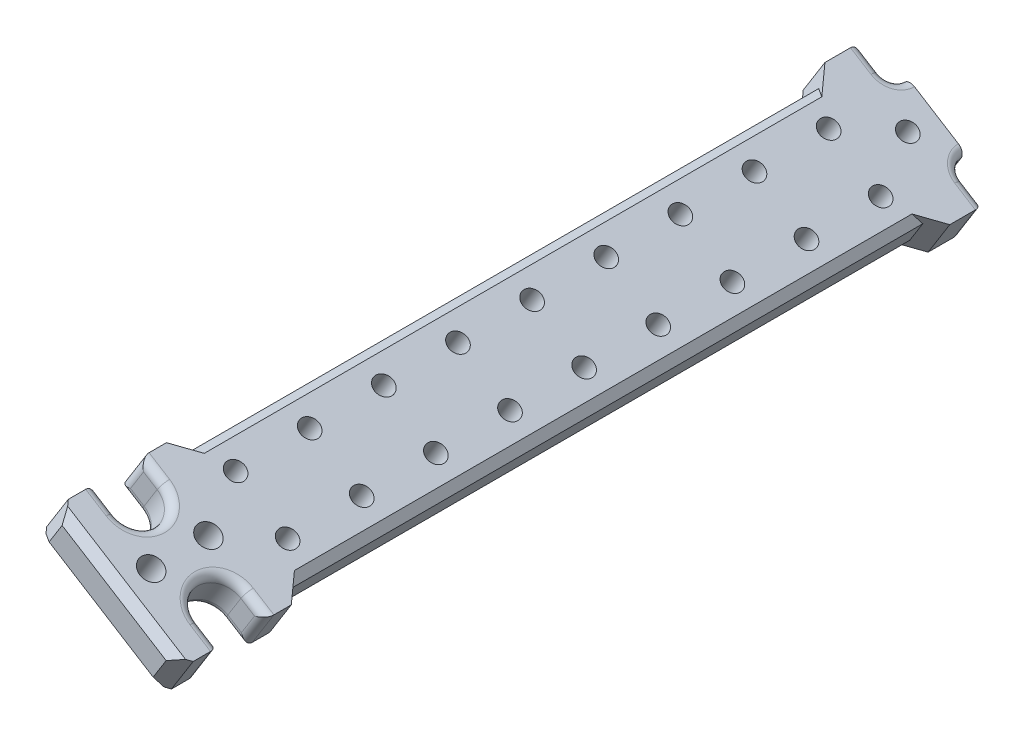
from build123d import *

# Parameters (mm, degrees)
BOSS_EXTRU_1_OUTLINE_R   = 2.75
BOSS_EXTRU_1_OUTLINE_R_2 = 2.3
BOSS_EXTRU_1_DEPTH       = 10
ESQUISSE2_R              = 2.3
ENL_V_MAT_EXTRU_1_DEPTH  = 191.138157298
CONG_1_R                 = 2
CHANFREIN1_SIZE          = 2
CONG_2_R                 = 2


# Read off the part's stored shape, not the designer's step: Boss.-Extru.1
with BuildPart() as part:
    # Boss.-Extru.1 outline → Boss.-Extru.1 (new body)
    with BuildSketch(Plane(origin=(0.807648755, 1.292238009, 0), x_dir=(0.8479983040028684, -0.5299989400067315, 0), z_dir=(0.5299989400067315, 0.8479983040028684, 0))):
        with BuildLine():
            Line((-3.319738136, 181.25), (-9.244866887, 181.25))
            ThreePointArc((-9.244866887, 181.25), (-11.896517316, 182.348349571), (-12.994866887, 185))
            Line((-12.994866887, 185), (-29.644053825, 185))
            ThreePointArc((-29.644053825, 185), (-30.742403396, 182.348349571), (-33.394053825, 181.25))
            Line((-33.394053825, 181.25), (-39.319182576, 181.25))
            Line((-39.319182576, 181.25), (-39.319182576, 173))
            Line((-39.319182576, 173), (-36.319182576, 170))
            Line((-36.319182576, 170), (-36.319182576, 15))
            Line((-36.319182576, 15), (-39.319182576, 12))
            Line((-39.319182576, 12), (-39.319182576, 5.75))
            Line((-39.319182576, 5.75), (-33.394053825, 5.75))
            ThreePointArc((-33.394053825, 5.75), (-27.644053825, 0), (-33.394053825, -5.75))
            Line((-33.394053825, -5.75), (-39.319182576, -5.75))
            Line((-39.319182576, -5.75), (-39.319182576, -12))
            Line((-39.319182576, -12), (-36.319182576, -15))
            Line((-36.319182576, -15), (-6.319738136, -15))
            Line((-6.319738136, -15), (-3.319738136, -12))
            Line((-3.319738136, -12), (-3.319738136, -5.75))
            Line((-3.319738136, -5.75), (-9.244866887, -5.75))
            ThreePointArc((-9.244866887, -5.75), (-14.994866887, 0), (-9.244866887, 5.75))
            Line((-9.244866887, 5.75), (-3.319738136, 5.75))
            Line((-3.319738136, 5.75), (-3.319738136, 12))
            Line((-3.319738136, 12), (-6.319738136, 15))
            Line((-6.319738136, 15), (-6.319738136, 170))
            Line((-6.319738136, 170), (-3.319738136, 173))
            Line((-3.319738136, 173), (-3.319738136, 181.25))
        make_face()
        with Locations((-21.319460356, -7)):
            Circle(BOSS_EXTRU_1_OUTLINE_R, mode=Mode.SUBTRACT)
        with Locations((-21.319460356, 7)):
            Circle(BOSS_EXTRU_1_OUTLINE_R, mode=Mode.SUBTRACT)
        with Locations((-21.319460356, 178)):
            Circle(BOSS_EXTRU_1_OUTLINE_R_2, mode=Mode.SUBTRACT)
    extrude(amount=BOSS_EXTRU_1_DEPTH)

    # Esquisse2 → Enlèv. mat.-Extru.1 (cut, through all)
    with BuildSketch(Plane(origin=(6.107638155, 9.772221049, 0), x_dir=(0.8479983040028684, -0.5299989400067316, 0), z_dir=(0.5299989400067316, 0.8479983040028684, 0))):
        with Locations(Location((-28.819321466, 146.875, 0), (0, 0, 180))):
            Circle(ESQUISSE2_R)
        with Locations(Location((-13.819599246, 146.875, 0), (0, 0, 180))):
            Circle(ESQUISSE2_R)
        with Locations(Location((-28.819321466, 128.75, 0), (0, 0, 180))):
            Circle(ESQUISSE2_R)
        with Locations(Location((-13.819599246, 128.75, 0), (0, 0, 180))):
            Circle(ESQUISSE2_R)
        with Locations(Location((-28.819321466, 110.625, 0), (0, 0, 180))):
            Circle(ESQUISSE2_R)
        with Locations(Location((-13.819599246, 110.625, 0), (0, 0, 180))):
            Circle(ESQUISSE2_R)
        with Locations(Location((-28.819321466, 92.5, 0), (0, 0, 180))):
            Circle(ESQUISSE2_R)
        with Locations(Location((-13.819599246, 92.5, 0), (0, 0, 180))):
            Circle(ESQUISSE2_R)
        with Locations(Location((-28.819321466, 74.375, 0), (0, 0, 180))):
            Circle(ESQUISSE2_R)
        with Locations(Location((-13.819599246, 74.375, 0), (0, 0, 180))):
            Circle(ESQUISSE2_R)
        with Locations(Location((-13.819599246, 56.25, 0), (0, 0, 180))):
            Circle(ESQUISSE2_R)
        with Locations(Location((-13.819599246, 38.125, 0), (0, 0, 180))):
            Circle(ESQUISSE2_R)
        with Locations(Location((-13.819599246, 20, 0), (0, 0, 180))):
            Circle(ESQUISSE2_R)
        with Locations(Location((-28.819321466, 38.125, 0), (0, 0, 180))):
            Circle(ESQUISSE2_R)
        with Locations(Location((-28.819321466, 20, 0), (0, 0, 180))):
            Circle(ESQUISSE2_R)
        with Locations(Location((-28.819321466, 56.25, 0), (0, 0, 180))):
            Circle(ESQUISSE2_R)
        with Locations(Location((-28.819321466, 165, 0), (0, 0, 180))):
            Circle(ESQUISSE2_R)
        with Locations(Location((-13.819599246, 165, 0), (0, 0, 180))):
            Circle(ESQUISSE2_R)
    extrude(amount=-ENL_V_MAT_EXTRU_1_DEPTH, mode=Mode.SUBTRACT)

    # Congé1
    cong_1_edges = [part.edges().sort_by_distance(p)[0] for p in [
        (-3.980588352, 16.077362616, -182.348349571),
        (0.78025628, 13.10183472, -181.25),
        (-19.961867785, 26.065662262, -182.348349571),
        (-24.722712418, 29.041190157, -181.25),
        (-4.51973312, 4.62185168, -181.25),
        (-30.022701818, 20.561207117, -181.25),
        (-25.261857185, 17.585679222, -182.348349571),
        (-9.280577752, 7.597379576, -182.348349571),
        (0.642511146, 7.291687222, -181.25),
        (-29.884956684, 26.371354616, -181.25),
    ]]
    fillet(cong_1_edges, radius=CONG_1_R)

    # Chanfrein1
    chanfrein1_edges = [part.edges().sort_by_distance(p)[0] for p in [
        (0.748510934, 13.121675562, -92.5),
        (-4.551478466, 4.641692522, -92.5),
        (-17.271217469, 12.591529399, 15),
        (-29.990956472, 20.541366276, -92.5),
        (-24.690967072, 29.021349316, -92.5),
        (-11.971228069, 21.071512439, 15),
    ]]
    chamfer(chanfrein1_edges, length=CHANFREIN1_SIZE)

    # Congé2
    cong_2_edges = [part.edges().sort_by_distance(p)[0] for p in [
        (0.78025628, 13.10183472, 5.75),
        (-6.607983534, 17.719484604, 0),
        (0.78025628, 13.10183472, -5.75),
        (-4.51973312, 4.62185168, -5.75),
        (-11.907972934, 9.239501564, 0),
        (-4.51973312, 4.62185168, 5.75),
        (-30.022701818, 20.561207117, 5.75),
        (-22.634462004, 15.943557233, 0),
        (-30.022701818, 20.561207117, -5.75),
        (0.642511146, 7.291687222, -5.75),
        (0.642511146, 7.291687222, 5.75),
        (-29.884956684, 26.371354616, 5.75),
        (-29.884956684, 26.371354616, -5.75),
        (-24.722712418, 29.041190157, -5.75),
        (-17.334472604, 24.423540273, 0),
        (-24.722712418, 29.041190157, 5.75),
    ]]
    fillet(cong_2_edges, radius=CONG_2_R)


solid = part.part
